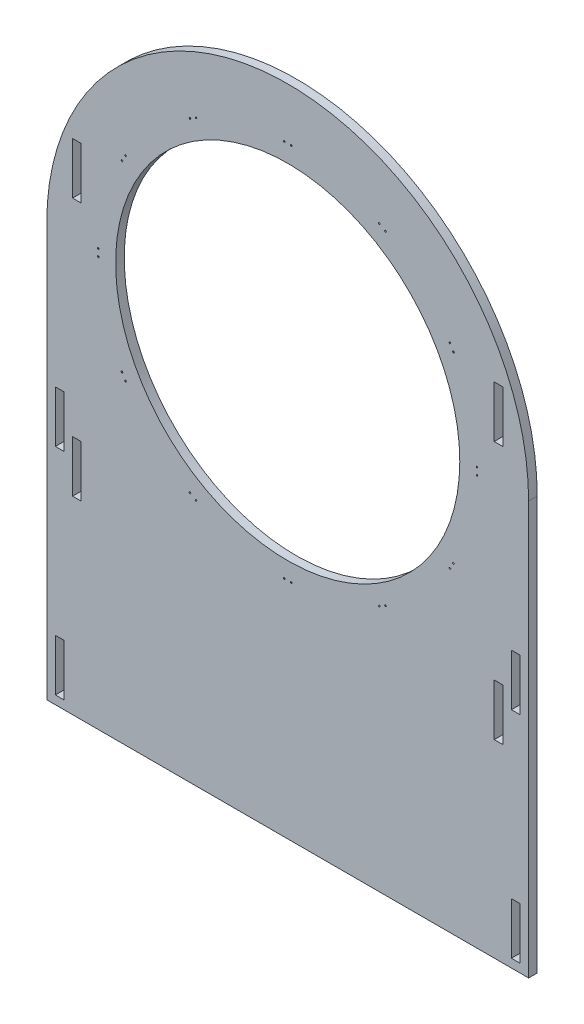
from build123d import *

# Parameters (mm, degrees)
SKETCH1_R           = 63.5
SKETCH1_W           = 0.5334
SKETCH1_H           = 0.5334
SKETCH1_W_2         = 3.175
SKETCH1_H_2         = 19.05
BOSS_EXTRUDE1_DEPTH = 3.175


with BuildPart() as part:
    # Sketch1 → Boss-Extrude1 (new body)
    with BuildSketch(Plane.XY):
        with BuildLine():
            Line((-88.9, 0), (-88.9, -152.4))
            Line((-88.9, -152.4), (88.9, -152.4))
            Line((88.9, -152.4), (88.9, 0))
            ThreePointArc((88.9, 0), (0, 88.9), (-88.9, 0))
        make_face()
        Circle(SKETCH1_R, mode=Mode.SUBTRACT)
        with Locations((-1.30175, 69.85)):
            Rectangle(SKETCH1_W, SKETCH1_H, mode=Mode.SUBTRACT)
        with Locations((1.30175, 69.85)):
            Rectangle(SKETCH1_W, SKETCH1_H, mode=Mode.SUBTRACT)
        Polygon((33.700032455, 61.50706843), (34.161970406, 61.24036843), (33.895270406, 60.778430479), (33.433332455, 61.045130479), align=None, mode=Mode.SUBTRACT)
        Polygon((35.954729594, 60.20531843), (35.688029594, 59.743380479), (36.149967545, 59.476680479), (36.416667545, 59.93861843), align=None, mode=Mode.SUBTRACT)
        Polygon((59.93861843, 36.416667545), (60.20531843, 35.954729594), (59.743380479, 35.688029594), (59.476680479, 36.149967545), align=None, mode=Mode.SUBTRACT)
        Polygon((61.24036843, 34.161970406), (60.778430479, 33.895270406), (61.045130479, 33.433332455), (61.50706843, 33.700032455), align=None, mode=Mode.SUBTRACT)
        with Locations((69.85, 1.30175)):
            Rectangle(SKETCH1_W, SKETCH1_H, mode=Mode.SUBTRACT)
        with Locations((69.85, -1.30175)):
            Rectangle(SKETCH1_W, SKETCH1_H, mode=Mode.SUBTRACT)
        Polygon((61.50706843, -33.700032455), (61.24036843, -34.161970406), (60.778430479, -33.895270406), (61.045130479, -33.433332455), align=None, mode=Mode.SUBTRACT)
        Polygon((60.20531843, -35.954729594), (59.743380479, -35.688029594), (59.476680479, -36.149967545), (59.93861843, -36.416667545), align=None, mode=Mode.SUBTRACT)
        Polygon((36.416667545, -59.93861843), (35.954729594, -60.20531843), (35.688029594, -59.743380479), (36.149967545, -59.476680479), align=None, mode=Mode.SUBTRACT)
        Polygon((34.161970406, -61.24036843), (33.895270406, -60.778430479), (33.433332455, -61.045130479), (33.700032455, -61.50706843), align=None, mode=Mode.SUBTRACT)
        with Locations((1.30175, -69.85)):
            Rectangle(SKETCH1_W, SKETCH1_H, mode=Mode.SUBTRACT)
        with Locations((-1.30175, -69.85)):
            Rectangle(SKETCH1_W, SKETCH1_H, mode=Mode.SUBTRACT)
        Polygon((-33.700032455, -61.50706843), (-34.161970406, -61.24036843), (-33.895270406, -60.778430479), (-33.433332455, -61.045130479), align=None, mode=Mode.SUBTRACT)
        Polygon((-35.954729594, -60.20531843), (-35.688029594, -59.743380479), (-36.149967545, -59.476680479), (-36.416667545, -59.93861843), align=None, mode=Mode.SUBTRACT)
        Polygon((-59.93861843, -36.416667545), (-60.20531843, -35.954729594), (-59.743380479, -35.688029594), (-59.476680479, -36.149967545), align=None, mode=Mode.SUBTRACT)
        Polygon((-61.24036843, -34.161970406), (-60.778430479, -33.895270406), (-61.045130479, -33.433332455), (-61.50706843, -33.700032455), align=None, mode=Mode.SUBTRACT)
        with Locations((-69.85, -1.30175)):
            Rectangle(SKETCH1_W, SKETCH1_H, mode=Mode.SUBTRACT)
        with Locations((-69.85, 1.30175)):
            Rectangle(SKETCH1_W, SKETCH1_H, mode=Mode.SUBTRACT)
        Polygon((-61.50706843, 33.700032455), (-61.24036843, 34.161970406), (-60.778430479, 33.895270406), (-61.045130479, 33.433332455), align=None, mode=Mode.SUBTRACT)
        Polygon((-60.20531843, 35.954729594), (-59.743380479, 35.688029594), (-59.476680479, 36.149967545), (-59.93861843, 36.416667545), align=None, mode=Mode.SUBTRACT)
        Polygon((-36.416667545, 59.93861843), (-35.954729594, 60.20531843), (-35.688029594, 59.743380479), (-36.149967545, 59.476680479), align=None, mode=Mode.SUBTRACT)
        Polygon((-34.161970406, 61.24036843), (-33.895270406, 60.778430479), (-33.433332455, 61.045130479), (-33.700032455, 61.50706843), align=None, mode=Mode.SUBTRACT)
        with Locations((-77.7875, 22.20976)):
            Rectangle(SKETCH1_W_2, SKETCH1_H_2, mode=Mode.SUBTRACT)
        with Locations((-77.7875, -73.04024)):
            Rectangle(SKETCH1_W_2, SKETCH1_H_2, mode=Mode.SUBTRACT)
        with Locations((-84.1375, -139.738361222)):
            Rectangle(SKETCH1_W_2, SKETCH1_H_2, mode=Mode.SUBTRACT)
        with Locations((-84.1375, -60.325)):
            Rectangle(SKETCH1_W_2, SKETCH1_H_2, mode=Mode.SUBTRACT)
        with Locations((84.1375, -139.738361222)):
            Rectangle(SKETCH1_W_2, SKETCH1_H_2, mode=Mode.SUBTRACT)
        with Locations((77.7875, 22.20976)):
            Rectangle(SKETCH1_W_2, SKETCH1_H_2, mode=Mode.SUBTRACT)
        with Locations((84.1375, -60.325)):
            Rectangle(SKETCH1_W_2, SKETCH1_H_2, mode=Mode.SUBTRACT)
        with Locations((77.7875, -73.04024)):
            Rectangle(SKETCH1_W_2, SKETCH1_H_2, mode=Mode.SUBTRACT)
    extrude(amount=BOSS_EXTRUDE1_DEPTH)


solid = part.part
